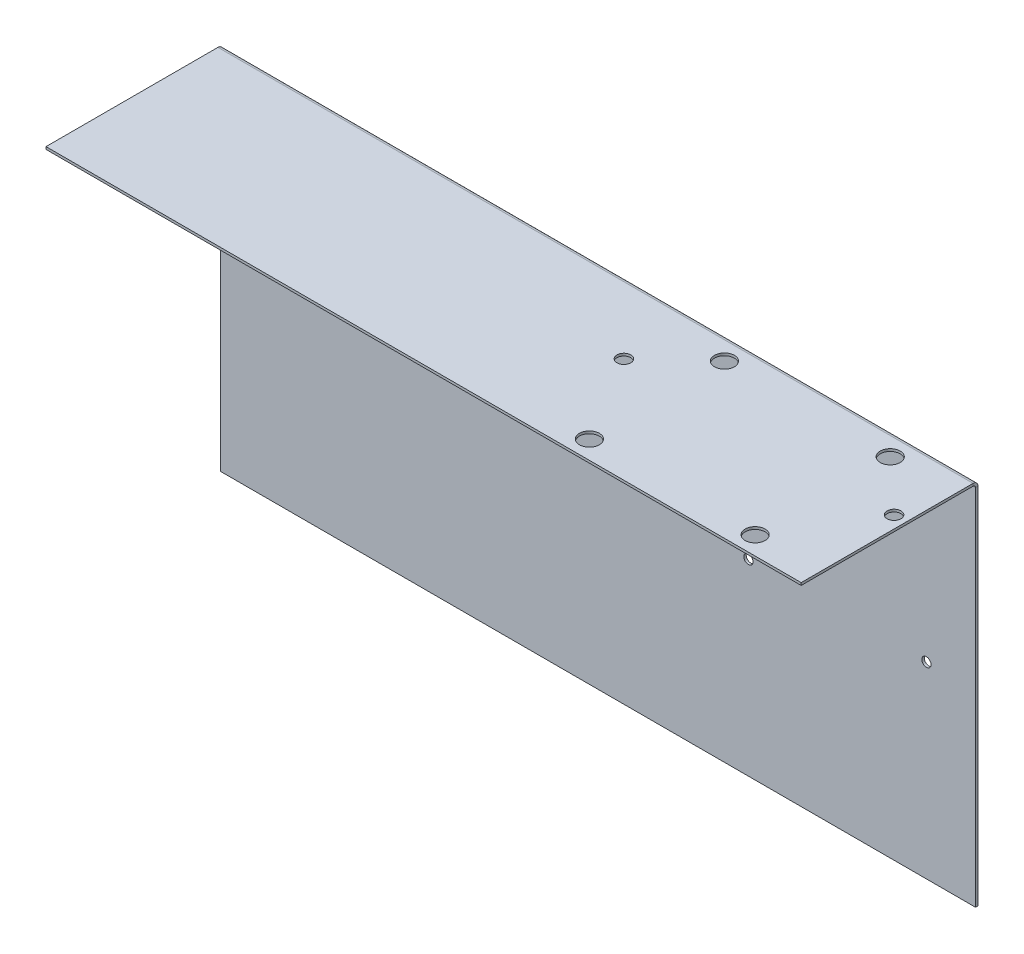
from build123d import *

# Parameters (mm, degrees)
CROQUIS1_R                  = 3.25
CROQUIS1_R_2                = 2.25
SALIENTE_EXTRUIR1_DEPTH     = 0.8
BRIDA_DE_ARISTA1_DEPTH      = 246
BRIDA_START                 = 0.8
BRIDA_DE_ARISTA1_PROFILE_W  = 246
BRIDA_DE_ARISTA1_PROFILE_H  = 118.4
BRIDA_DE_ARISTA1_PROFILE_R  = 1.5
BRIDA_DE_ARISTA1_FLAT_DEPTH = 0.8


# Sheet-metal steps are written as plain solids
with BuildPart() as part:
    # Croquis1 → Saliente-Extruir1 (new body)
    with BuildSketch(Plane(origin=(0, 0, 0), x_dir=(1, 0, 0), z_dir=(0, 1, 0))):
        Polygon((0, 56), (96, 56), (96, 0), (0, 0), (-150, 0), (-150, 56), align=None)
        with Locations(Location((21, 50, 0), (0, 0, 270))):
            Circle(CROQUIS1_R, mode=Mode.SUBTRACT)
        with Locations(Location((75, 50, 0), (0, 0, 90))):
            Circle(CROQUIS1_R, mode=Mode.SUBTRACT)
        with Locations(Location((75, 6, 0), (0, 0, 270))):
            Circle(CROQUIS1_R, mode=Mode.SUBTRACT)
        with Locations(Location((21, 6, 0), (0, 0, 90))):
            Circle(CROQUIS1_R, mode=Mode.SUBTRACT)
        with Locations(Location((92, 34.25, 0), (0, 0, 270))):
            Circle(CROQUIS1_R_2, mode=Mode.SUBTRACT)
        with Locations(Location((4, 34.25, 0), (0, 0, 90))):
            Circle(CROQUIS1_R_2, mode=Mode.SUBTRACT)
    extrude(amount=SALIENTE_EXTRUIR1_DEPTH)

    # Brida de arista1 bend section (across the edge) → Brida de arista1 (add)
    with BuildSketch(Plane(origin=(-150, 0, -56.8), x_dir=(0, 0, 1), z_dir=(1, 0, 0))):
        with BuildLine():
            Line((-0.8, 0.8), (0, 0.8))
            ThreePointArc((0, 0.8), (0.234314575, 0.234314575), (0.8, 0))
            Line((0.8, 0), (0.8, -0.8))
            ThreePointArc((0.8, -0.8), (-0.33137085, -0.33137085), (-0.8, 0.8))
        make_face()
    extrude(amount=BRIDA_DE_ARISTA1_DEPTH)

    # Brida de arista1 profile (on flange) → Brida de arista1 flat (add)
    with BuildSketch(Plane(origin=(0, 0, -56.8), x_dir=(1, 0, 0), z_dir=(0, 0, -1)).offset(BRIDA_START)):
        with Locations((-27, 60)):
            Rectangle(BRIDA_DE_ARISTA1_PROFILE_W, BRIDA_DE_ARISTA1_PROFILE_H)
        with Locations((22, 9)):
            Circle(BRIDA_DE_ARISTA1_PROFILE_R, mode=Mode.SUBTRACT)
        with Locations((80, 9)):
            Circle(BRIDA_DE_ARISTA1_PROFILE_R, mode=Mode.SUBTRACT)
        with Locations((22, 58)):
            Circle(BRIDA_DE_ARISTA1_PROFILE_R, mode=Mode.SUBTRACT)
        with Locations((80, 58)):
            Circle(BRIDA_DE_ARISTA1_PROFILE_R, mode=Mode.SUBTRACT)
    extrude(amount=-BRIDA_DE_ARISTA1_FLAT_DEPTH)


solid = part.part
